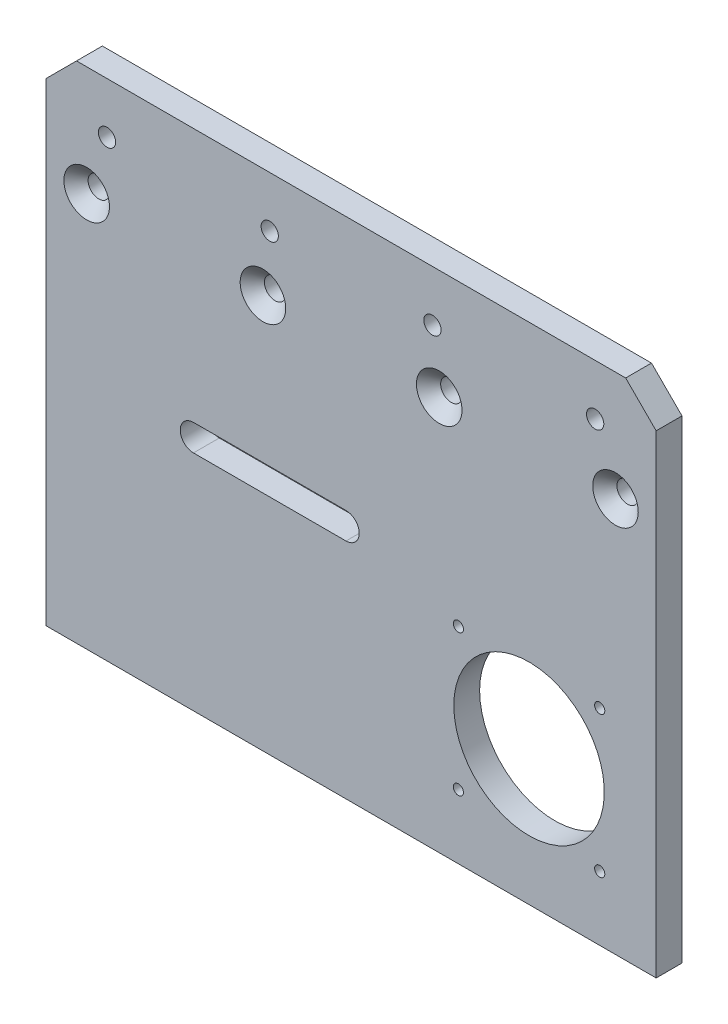
from build123d import *

# Parameters (mm, degrees)
FLANGE_BASE1_START                    = -6.35
FLANGE_BASE1_OUTLINE_W                = 300
FLANGE_BASE1_OUTLINE_H                = 248
FLANGE_BASE1_DEPTH                    = 12.7
QUEBRA_CANTO1_START                   = -6.35
QUEBRA_CANTO1_DEPTH                   = 12.7
FURO_ROSCADO_DE_M10X1_52_D            = 8.5
FURO_ROSCADO_DE_M10X1_52_DEPTH        = 29.946342369
FURO_ROSCADO_DE_M10X1_52_TIP          = 2.553657631
ESBO_O11_R                            = 16.5
CORTE_EXTRUS_O1_DEPTH                 = 196.031510275
ESBO_O12_R                            = 37
CORTE_EXTRUS_O2_DEPTH                 = 196.031510275
FURO_ROSCADO_DE_M6X1_01_D             = 5
CORTE_EXTRUS_O5_DEPTH                 = 12.7
ESCAREADO_PARA_SFHCS_M101_D           = 10.5
ESCAREADO_PARA_SFHCS_M101_DEPTH       = 32.5
ESCAREADO_PARA_SFHCS_M101_CSINK_D     = 22.4
ESCAREADO_PARA_SFHCS_M101_CSINK_ANGLE = 90
ESCAREADO_PARA_SFHCS_M101_TIP         = 3.15451825


# Read off the part's stored shape, not the designer's step: Flange-base1, Quebra-Canto1
with BuildPart() as part:
    # Flange-base1 outline → Flange-base1 (new body)
    with BuildSketch(Plane.XY.offset(FLANGE_BASE1_START)):
        Rectangle(FLANGE_BASE1_OUTLINE_W, FLANGE_BASE1_OUTLINE_H)
    extrude(amount=FLANGE_BASE1_DEPTH)

    # Quebra-Canto1 outline → Quebra-Canto1 (cut)
    with BuildSketch(Plane.XY.offset(QUEBRA_CANTO1_START)):
        Polygon((-150, 124), (-150, 109), (-135, 124), align=None)
        Polygon((150, 124), (135, 124), (150, 109), align=None)
    extrude(amount=QUEBRA_CANTO1_DEPTH, mode=Mode.SUBTRACT)

    # Furo roscado de M10x1.52
    with Locations(Plane.XY.offset(6.35)):
        with Locations((-40, 99), (-120, 99), (40, 99), (120, 99)):
            Hole(FURO_ROSCADO_DE_M10X1_52_D / 2, depth=FURO_ROSCADO_DE_M10X1_52_DEPTH)
            with Locations((0, 0, -(FURO_ROSCADO_DE_M10X1_52_DEPTH + FURO_ROSCADO_DE_M10X1_52_TIP / 2))):  # 118° drill point
                Cone(0, FURO_ROSCADO_DE_M10X1_52_D / 2, FURO_ROSCADO_DE_M10X1_52_TIP, mode=Mode.SUBTRACT)

    # Esboço11 → Corte-extrusão1 (cut, through all)
    with BuildSketch(Plane.XY.offset(6.35)):
        with Locations((87.5, -57.664450339)):
            Circle(ESBO_O11_R)
    extrude(amount=-CORTE_EXTRUS_O1_DEPTH, mode=Mode.SUBTRACT)

    # Esboço12 → Corte-extrusão2 (cut, through all)
    with BuildSketch(Plane(origin=(0, 0, -6.35), x_dir=(-1, 0, 0), z_dir=(0, 0, -1))):
        with Locations((-87.5, -57.664450339)):
            Circle(ESBO_O12_R)
    extrude(amount=-CORTE_EXTRUS_O2_DEPTH, mode=Mode.SUBTRACT)

    # Furo roscado de M6x1.01 (through all)
    with Locations(Plane(origin=(0, 0, -6.35), x_dir=(-1, 0, 0), z_dir=(0, 0, -1))):
        with Locations((-122.25, -22.914450339), (-87.5, -57.664450339), (-52.75, -92.414450339), (-52.75, -22.914450339), (-122.25, -92.414450339)):
            Hole(FURO_ROSCADO_DE_M6X1_01_D / 2)

    # Esboço20 → Corte-extrusão5 (cut)
    with BuildSketch(Plane.XY.offset(6.35)):
        with BuildLine():
            Line((-2.5, -14.164450339), (-77.5, -14.164450339))
            ThreePointArc((-77.5, -14.164450339), (-84, -7.664450339), (-77.5, -1.164450339))
            Line((-77.5, -1.164450339), (-2.5, -1.164450339))
            ThreePointArc((-2.5, -1.164450339), (4, -7.664450339), (-2.5, -14.164450339))
        make_face()
    extrude(amount=-CORTE_EXTRUS_O5_DEPTH, mode=Mode.SUBTRACT)

    # Escareado para SFHCS M101
    with Locations(Plane.XY.offset(6.35)):
        with Locations((-130, 70), (-43.333333333, 70), (43.333333333, 70), (130, 70)):
            CounterSinkHole(ESCAREADO_PARA_SFHCS_M101_D / 2, ESCAREADO_PARA_SFHCS_M101_CSINK_D / 2, depth=ESCAREADO_PARA_SFHCS_M101_DEPTH, counter_sink_angle=ESCAREADO_PARA_SFHCS_M101_CSINK_ANGLE)
            with Locations((0, 0, -(ESCAREADO_PARA_SFHCS_M101_DEPTH + ESCAREADO_PARA_SFHCS_M101_TIP / 2))):  # 118° drill point
                Cone(0, ESCAREADO_PARA_SFHCS_M101_D / 2, ESCAREADO_PARA_SFHCS_M101_TIP, mode=Mode.SUBTRACT)


solid = part.part
